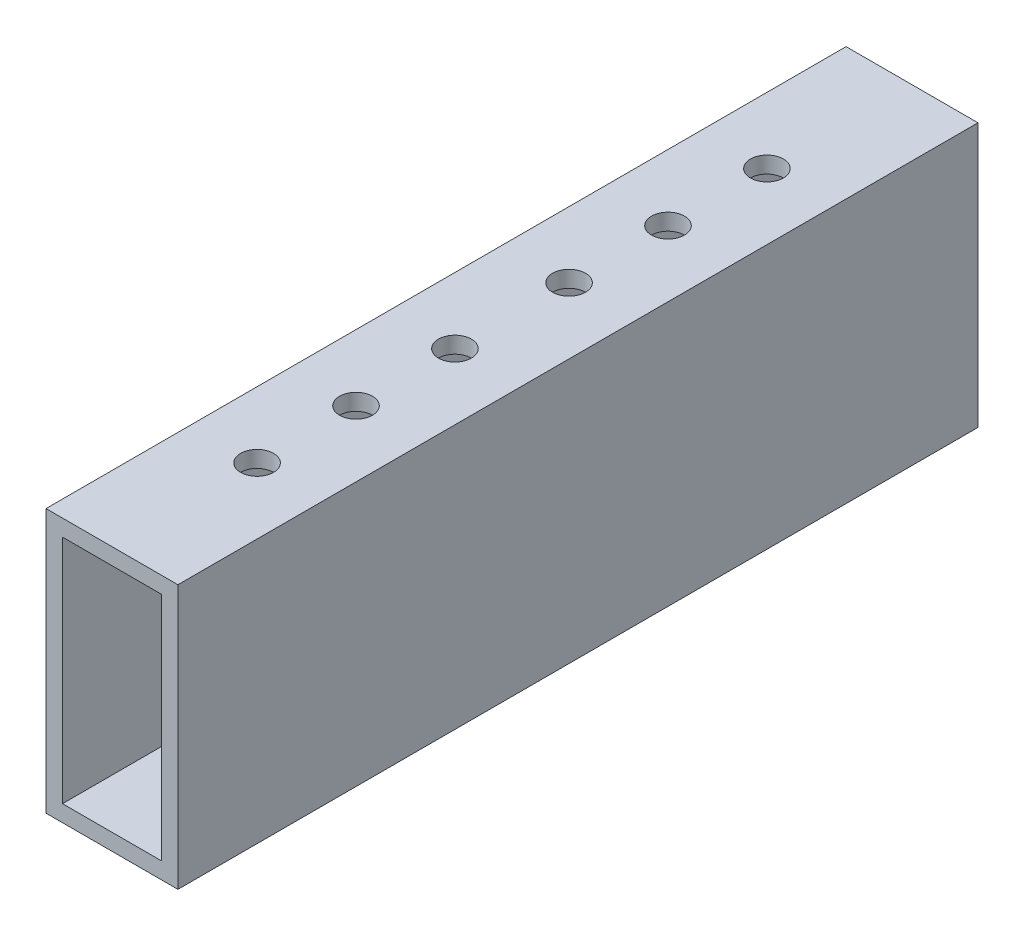
from build123d import *

# Parameters (mm, degrees)
SKETCH1_W           = 25.4
SKETCH1_H           = 50.8
SKETCH1_W_2         = 19.05
SKETCH1_H_2         = 44.45
BOSS_EXTRUDE1_DEPTH = 154.051
SKETCH2_R           = 3.175
CUT_EXTRUDE1_DEPTH  = 165.187425222


with BuildPart() as part:
    # Sketch1 → Boss-Extrude1 (new body)
    with BuildSketch(Plane.XY):
        with Locations((12.7, 25.4)):
            Rectangle(SKETCH1_W, SKETCH1_H)
        with Locations((12.7, 25.4)):
            Rectangle(SKETCH1_W_2, SKETCH1_H_2, mode=Mode.SUBTRACT)
    extrude(amount=BOSS_EXTRUDE1_DEPTH)

    # Sketch2 → Cut-Extrude1 (cut, through all)
    with BuildSketch(Plane(origin=(0, 50.8, 0), x_dir=(1, 0, 0), z_dir=(0, 1, 0))):
        with Locations((12.7, -126.111)):
            Circle(SKETCH2_R)
        with Locations((12.7, -107.061)):
            Circle(SKETCH2_R)
        with Locations((12.7, -88.011)):
            Circle(SKETCH2_R)
        with Locations((12.7, -27.94)):
            Circle(SKETCH2_R)
        with Locations((12.7, -46.99)):
            Circle(SKETCH2_R)
        with Locations((12.7, -66.04)):
            Circle(SKETCH2_R)
    extrude(amount=-CUT_EXTRUDE1_DEPTH, mode=Mode.SUBTRACT)


solid = part.part
